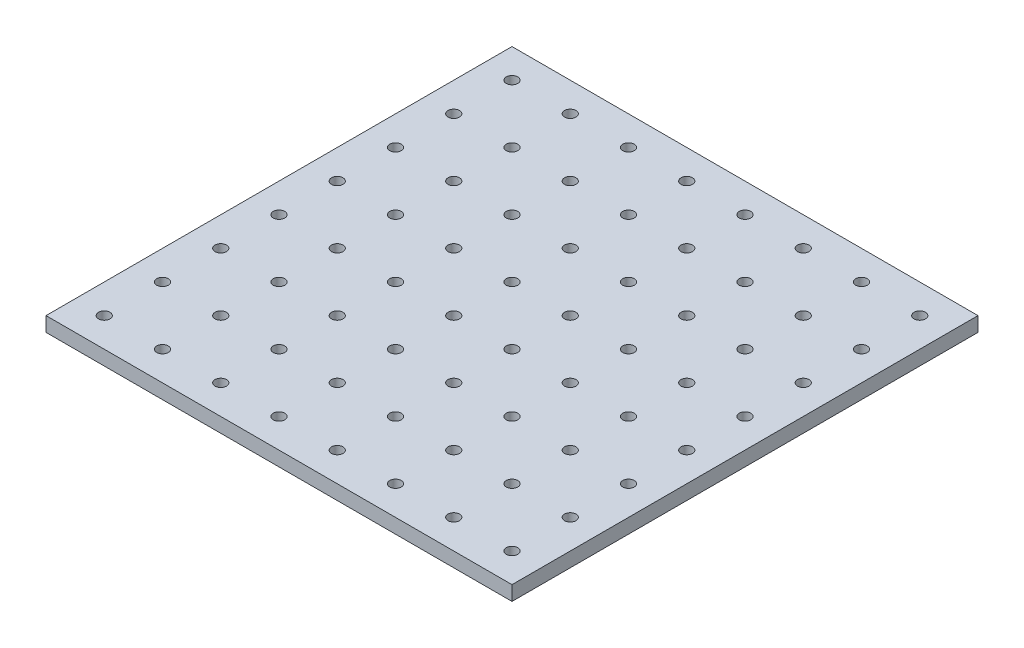
from build123d import *

# Parameters (mm, degrees)
SKETCH1_W           = 203.2
SKETCH1_H           = 203.2
SKETCH1_R           = 2.5
BOSS_EXTRUDE1_DEPTH = 6.35


with BuildPart() as part:
    # Sketch1 → Boss-Extrude1 (new body)
    with BuildSketch(Plane(origin=(0, 0, 0), x_dir=(1, 0, 0), z_dir=(0, 1, 0))):
        with Locations((-25.4, 25.4)):
            Rectangle(SKETCH1_W, SKETCH1_H)
        with Locations((-114.3, 114.3)):
            Circle(SKETCH1_R, mode=Mode.SUBTRACT)
        with Locations((-88.9, 114.3)):
            Circle(SKETCH1_R, mode=Mode.SUBTRACT)
        with Locations((-63.5, 114.3)):
            Circle(SKETCH1_R, mode=Mode.SUBTRACT)
        with Locations((-38.1, 114.3)):
            Circle(SKETCH1_R, mode=Mode.SUBTRACT)
        with Locations((-12.7, 114.3)):
            Circle(SKETCH1_R, mode=Mode.SUBTRACT)
        with Locations((12.7, 114.3)):
            Circle(SKETCH1_R, mode=Mode.SUBTRACT)
        with Locations((38.1, 114.3)):
            Circle(SKETCH1_R, mode=Mode.SUBTRACT)
        with Locations((63.5, 114.3)):
            Circle(SKETCH1_R, mode=Mode.SUBTRACT)
        with Locations((-88.9, 88.9)):
            Circle(SKETCH1_R, mode=Mode.SUBTRACT)
        with Locations((-63.5, 88.9)):
            Circle(SKETCH1_R, mode=Mode.SUBTRACT)
        with Locations((-38.1, 88.9)):
            Circle(SKETCH1_R, mode=Mode.SUBTRACT)
        with Locations((-12.7, 88.9)):
            Circle(SKETCH1_R, mode=Mode.SUBTRACT)
        with Locations((12.7, 88.9)):
            Circle(SKETCH1_R, mode=Mode.SUBTRACT)
        with Locations((38.1, 88.9)):
            Circle(SKETCH1_R, mode=Mode.SUBTRACT)
        with Locations((63.5, 88.9)):
            Circle(SKETCH1_R, mode=Mode.SUBTRACT)
        with Locations((-88.9, 63.5)):
            Circle(SKETCH1_R, mode=Mode.SUBTRACT)
        with Locations((-63.5, 63.5)):
            Circle(SKETCH1_R, mode=Mode.SUBTRACT)
        with Locations((-38.1, 63.5)):
            Circle(SKETCH1_R, mode=Mode.SUBTRACT)
        with Locations((-12.7, 63.5)):
            Circle(SKETCH1_R, mode=Mode.SUBTRACT)
        with Locations((12.7, 63.5)):
            Circle(SKETCH1_R, mode=Mode.SUBTRACT)
        with Locations((38.1, 63.5)):
            Circle(SKETCH1_R, mode=Mode.SUBTRACT)
        with Locations((63.5, 63.5)):
            Circle(SKETCH1_R, mode=Mode.SUBTRACT)
        with Locations((-88.9, 38.1)):
            Circle(SKETCH1_R, mode=Mode.SUBTRACT)
        with Locations((-63.5, 38.1)):
            Circle(SKETCH1_R, mode=Mode.SUBTRACT)
        with Locations((-38.1, 38.1)):
            Circle(SKETCH1_R, mode=Mode.SUBTRACT)
        with Locations((-12.7, 38.1)):
            Circle(SKETCH1_R, mode=Mode.SUBTRACT)
        with Locations((12.7, 38.1)):
            Circle(SKETCH1_R, mode=Mode.SUBTRACT)
        with Locations((38.1, 38.1)):
            Circle(SKETCH1_R, mode=Mode.SUBTRACT)
        with Locations((63.5, 38.1)):
            Circle(SKETCH1_R, mode=Mode.SUBTRACT)
        with Locations((-88.9, 12.7)):
            Circle(SKETCH1_R, mode=Mode.SUBTRACT)
        with Locations((-63.5, 12.7)):
            Circle(SKETCH1_R, mode=Mode.SUBTRACT)
        with Locations((-38.1, 12.7)):
            Circle(SKETCH1_R, mode=Mode.SUBTRACT)
        with Locations((-12.7, 12.7)):
            Circle(SKETCH1_R, mode=Mode.SUBTRACT)
        with Locations((12.7, 12.7)):
            Circle(SKETCH1_R, mode=Mode.SUBTRACT)
        with Locations((38.1, 12.7)):
            Circle(SKETCH1_R, mode=Mode.SUBTRACT)
        with Locations((63.5, 12.7)):
            Circle(SKETCH1_R, mode=Mode.SUBTRACT)
        with Locations((-88.9, -12.7)):
            Circle(SKETCH1_R, mode=Mode.SUBTRACT)
        with Locations((-63.5, -12.7)):
            Circle(SKETCH1_R, mode=Mode.SUBTRACT)
        with Locations((-38.1, -12.7)):
            Circle(SKETCH1_R, mode=Mode.SUBTRACT)
        with Locations((-12.7, -12.7)):
            Circle(SKETCH1_R, mode=Mode.SUBTRACT)
        with Locations((12.7, -12.7)):
            Circle(SKETCH1_R, mode=Mode.SUBTRACT)
        with Locations((38.1, -12.7)):
            Circle(SKETCH1_R, mode=Mode.SUBTRACT)
        with Locations((63.5, -12.7)):
            Circle(SKETCH1_R, mode=Mode.SUBTRACT)
        with Locations((-88.9, -38.1)):
            Circle(SKETCH1_R, mode=Mode.SUBTRACT)
        with Locations((-63.5, -38.1)):
            Circle(SKETCH1_R, mode=Mode.SUBTRACT)
        with Locations((-38.1, -38.1)):
            Circle(SKETCH1_R, mode=Mode.SUBTRACT)
        with Locations((-12.7, -38.1)):
            Circle(SKETCH1_R, mode=Mode.SUBTRACT)
        with Locations((12.7, -38.1)):
            Circle(SKETCH1_R, mode=Mode.SUBTRACT)
        with Locations((38.1, -38.1)):
            Circle(SKETCH1_R, mode=Mode.SUBTRACT)
        with Locations((63.5, -38.1)):
            Circle(SKETCH1_R, mode=Mode.SUBTRACT)
        with Locations((-88.9, -63.5)):
            Circle(SKETCH1_R, mode=Mode.SUBTRACT)
        with Locations((-63.5, -63.5)):
            Circle(SKETCH1_R, mode=Mode.SUBTRACT)
        with Locations((-38.1, -63.5)):
            Circle(SKETCH1_R, mode=Mode.SUBTRACT)
        with Locations((-12.7, -63.5)):
            Circle(SKETCH1_R, mode=Mode.SUBTRACT)
        with Locations((12.7, -63.5)):
            Circle(SKETCH1_R, mode=Mode.SUBTRACT)
        with Locations((38.1, -63.5)):
            Circle(SKETCH1_R, mode=Mode.SUBTRACT)
        with Locations((63.5, -63.5)):
            Circle(SKETCH1_R, mode=Mode.SUBTRACT)
        with Locations((-114.3, 88.9)):
            Circle(SKETCH1_R, mode=Mode.SUBTRACT)
        with Locations((-114.3, 63.5)):
            Circle(SKETCH1_R, mode=Mode.SUBTRACT)
        with Locations((-114.3, 38.1)):
            Circle(SKETCH1_R, mode=Mode.SUBTRACT)
        with Locations((-114.3, 12.7)):
            Circle(SKETCH1_R, mode=Mode.SUBTRACT)
        with Locations((-114.3, -12.7)):
            Circle(SKETCH1_R, mode=Mode.SUBTRACT)
        with Locations((-114.3, -38.1)):
            Circle(SKETCH1_R, mode=Mode.SUBTRACT)
        with Locations((-114.3, -63.5)):
            Circle(SKETCH1_R, mode=Mode.SUBTRACT)
    extrude(amount=BOSS_EXTRUDE1_DEPTH)


solid = part.part
